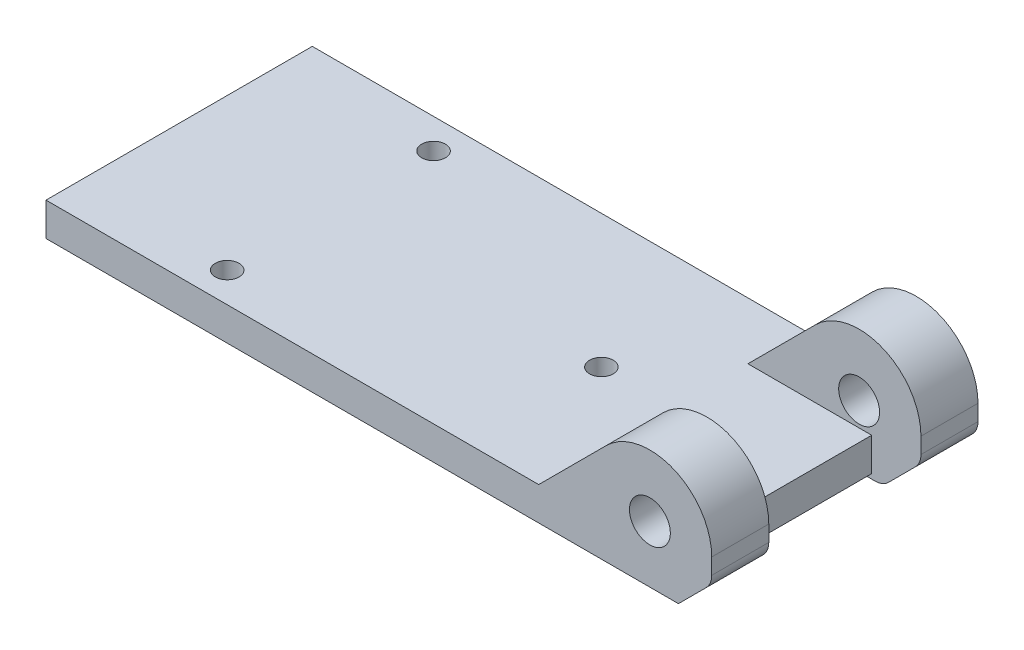
from build123d import *

# Parameters (mm, degrees)
SKIZZE1_W                           = 70
SKIZZE1_H                           = 28
AUFSATZ_LINEAR_AUSTRAGEN1_DEPTH     = 4
SKIZZE2_R                           = 2.15
AUFSATZ_LINEAR_AUSTRAGEN2_DEPTH     = 6
VERRUNDUNG1_R                       = 6.5
VERRUNDUNG1_OF_SPIEGELN1_R          = 6.5
FASE1_SIZE                          = 4
VERRUNDUNG2_R                       = 2
SCHNITT_LINEAR_START                = -5
SCHNITT_LINEAR_AUSTRAGEN1_OUTLINE_W = 6.179640558
SCHNITT_LINEAR_AUSTRAGEN1_OUTLINE_H = 16
SCHNITT_LINEAR_AUSTRAGEN1_DEPTH     = 5.828427125
SCHNITT_LINEAR_AUSTRAGEN2_REACH     = 40.756
SKIZZE4_R                           = 1.25
FASE2_SIZE                          = 0.5


with BuildPart() as part:
    # Skizze1 → Aufsatz-Linear austragen1 (new body)
    with BuildSketch(Plane(origin=(0, 0, 0), x_dir=(1, 0, 0), z_dir=(0, 1, 0))):
        Rectangle(SKIZZE1_W, SKIZZE1_H)
    extrude(amount=AUFSATZ_LINEAR_AUSTRAGEN1_DEPTH)

    # Skizze2 → Aufsatz-Linear austragen2 (add)
    with BuildSketch(Plane.XY.offset(14)):
        Polygon((16.807611845, 4), (25.807611845, 13), (35, 13), (35, 4), align=None)
        with Locations((28.5, 6.5)):
            Circle(SKIZZE2_R, mode=Mode.SUBTRACT)
    aufsatz_linear_austragen2 = extrude(amount=-AUFSATZ_LINEAR_AUSTRAGEN2_DEPTH)

    # Verrundung1
    verrundung1_edges = [part.edges().sort_by_distance(p)[0] for p in [
        (25.807611845, 13, 11),
        (35, 13, 11),
    ]]
    fillet(verrundung1_edges, radius=VERRUNDUNG1_R - 0.0001)  # a hair under: the kernel refuses the full size

    # Spiegeln1: Aufsatz-Linear austragen2 across plane
    add(aufsatz_linear_austragen2.mirror(Plane.XY))

    # Verrundung1 of Spiegeln1
    verrundung1_of_spiegeln1_edges = [part.edges().sort_by_distance(p)[0] for p in [
        (25.807611845, 13, -11),
        (35, 13, -11),
    ]]
    fillet(verrundung1_of_spiegeln1_edges, radius=VERRUNDUNG1_OF_SPIEGELN1_R - 0.0001)  # a hair under: the kernel refuses the full size

    # Fase1
    fase1_edges = [part.edges().sort_by_distance(p)[0] for p in [
        (35, 0, 0),
    ]]
    chamfer(fase1_edges, length=FASE1_SIZE - 0.0001)  # a hair under: the kernel refuses the full size

    # Verrundung2
    # the kernel refuses this fillet: 2 mm, written as the material it takes off along each edge
    with BuildSketch(Plane(origin=(31.0001, 0, 16.071067812), x_dir=(0.7071067811865477, 0.7071067811865474, 0), z_dir=(0, 0, -1)), Plane(origin=(35, 3.9999, 16.071067812), x_dir=(0, 1, 0), z_dir=(0, 0, -1))) as verrundung2_piece_1:
        with BuildLine():
            CenterArc((VERRUNDUNG2_R * 0.414213562373, -VERRUNDUNG2_R), VERRUNDUNG2_R, 90, 45)
            Line((-VERRUNDUNG2_R * 0.292893218813, -VERRUNDUNG2_R * 0.292893218813), (0, 0))
            Line((0, 0), (VERRUNDUNG2_R * 0.414213562373, 0))
        make_face()
    extrude(amount=32.142135624, mode=Mode.SUBTRACT)

    # Schnitt-Linear austragen1: read off the stored shape, not the designer's step
    # Schnitt-Linear austragen1 outline → Schnitt-Linear austragen1 (cut)
    with BuildSketch(Plane(origin=(0, 4, 0), x_dir=(1, 0, 0), z_dir=(0, 1, 0)).offset(SCHNITT_LINEAR_START)):
        with Locations((32.910179721, 0)):
            Rectangle(SCHNITT_LINEAR_AUSTRAGEN1_OUTLINE_W, SCHNITT_LINEAR_AUSTRAGEN1_OUTLINE_H)
    extrude(amount=SCHNITT_LINEAR_AUSTRAGEN1_DEPTH, mode=Mode.SUBTRACT)

    # Skizze4 → Schnitt-Linear austragen2 (cut, up to next)
    with BuildSketch(Plane(origin=(0, 4, 0), x_dir=(1, 0, 0), z_dir=(0, 1, 0)), mode=Mode.PRIVATE) as schnitt_linear_austragen2_sk1:
        with Locations(Location((-19.1, -10.85, 0), (0, 0, 270))):
            Circle(SKIZZE4_R)
    schnitt_linear_austragen2_tool1 = extrude(schnitt_linear_austragen2_sk1.sketch, amount=-SCHNITT_LINEAR_AUSTRAGEN2_REACH, mode=Mode.PRIVATE) & part.part
    # Skizze4 → Schnitt-Linear austragen2 (cut, up to next)
    with BuildSketch(Plane(origin=(0, 4, 0), x_dir=(1, 0, 0), z_dir=(0, 1, 0)), mode=Mode.PRIVATE) as schnitt_linear_austragen2_sk2:
        with Locations(Location((9.4, 0, 0), (0, 0, 270))):
            Circle(SKIZZE4_R)
    schnitt_linear_austragen2_tool2 = extrude(schnitt_linear_austragen2_sk2.sketch, amount=-SCHNITT_LINEAR_AUSTRAGEN2_REACH, mode=Mode.PRIVATE) & part.part
    # Skizze4 → Schnitt-Linear austragen2 (cut, up to next)
    with BuildSketch(Plane(origin=(0, 4, 0), x_dir=(1, 0, 0), z_dir=(0, 1, 0)), mode=Mode.PRIVATE) as schnitt_linear_austragen2_sk3:
        with Locations(Location((-19.1, 10.85, 0), (0, 0, 270))):
            Circle(SKIZZE4_R)
    schnitt_linear_austragen2_tool3 = extrude(schnitt_linear_austragen2_sk3.sketch, amount=-SCHNITT_LINEAR_AUSTRAGEN2_REACH, mode=Mode.PRIVATE) & part.part
    add(schnitt_linear_austragen2_tool1.solids().sort_by_distance((-19.1, 4, 10.85))[0], mode=Mode.SUBTRACT)
    add(schnitt_linear_austragen2_tool2.solids().sort_by_distance((9.4, 4, 0))[0], mode=Mode.SUBTRACT)
    add(schnitt_linear_austragen2_tool3.solids().sort_by_distance((-19.1, 4, -10.85))[0], mode=Mode.SUBTRACT)

    # Fase2
    # the kernel refuses this chamfer: 0.5 mm, written as the material it takes off along each edge
    with BuildSketch(Plane(origin=(-36.285841494, 0, 14), x_dir=(0, 0, -1), z_dir=(1, 0, 0))) as fase2_piece_1:
        Polygon((FASE2_SIZE, 0), (0, FASE2_SIZE), (0, 0), align=None)
    extrude(amount=68.643444909, mode=Mode.SUBTRACT)
    with BuildSketch(Plane(origin=(-35, 0, -15.285841494), x_dir=(1, 0, 0), z_dir=(0, 0, 1))) as fase2_piece_2:
        Polygon((FASE2_SIZE, 0), (0, FASE2_SIZE), (0, 0), align=None)
    extrude(amount=30.571682988, mode=Mode.SUBTRACT)
    with BuildSketch(Plane(origin=(32.357603415, 0, -14), x_dir=(0, 1, 0), z_dir=(-1, 0, 0))) as fase2_piece_3:
        Polygon((FASE2_SIZE, 0), (0, -FASE2_SIZE), (0, 0), align=None)
    extrude(amount=68.643444909, mode=Mode.SUBTRACT)
    with BuildSketch(Plane(origin=(29.820359442, 0, 8), x_dir=(-1, 0, 0), z_dir=(0, 0, -1))) as fase2_piece_4:
        Polygon((FASE2_SIZE, 0), (0, FASE2_SIZE), (0, 0), align=None)
    extrude(amount=16, mode=Mode.SUBTRACT)


solid = part.part
